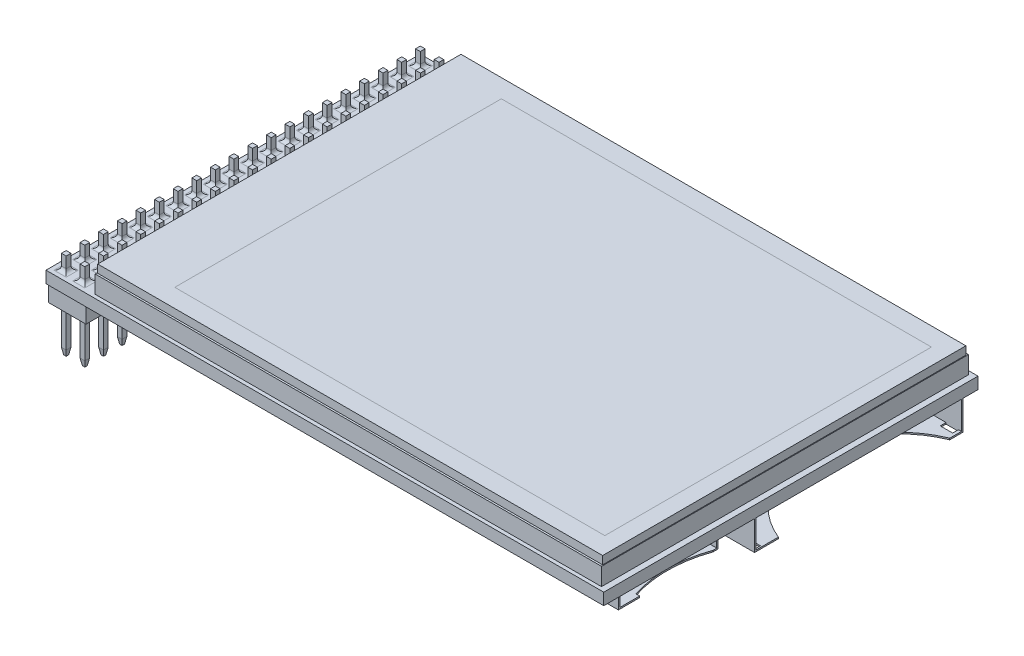
from build123d import *
from OCP.BRepFilletAPI import BRepFilletAPI_MakeChamfer

# Parameters (mm, degrees)
SKETCH_1_W       = 76
SKETCH_1_H       = 51
EXTRUDE_1_DEPTH  = 1.6
SKETCH_2_W       = 5.1
SKETCH_2_H       = 50.5
EXTRUDE_2_DEPTH  = 2.3
SKETCH_3_W       = 0.65
SKETCH_3_H       = 0.65
EXTRUDE_3_DEPTH  = 6.1
SKETCH_4_W       = 0.65
SKETCH_4_H       = 0.65
EXTRUDE_4_DEPTH  = 2
CHAMFER_1_SIZE   = 0.16
CHAMFER_1_SIZE2  = 0.907405091
FILLET_1_R       = 0.5
SKETCH_5_W       = 69
SKETCH_5_H       = 50
EXTRUDE_5_DEPTH  = 2.4
SKETCH_6_W       = 68.8
SKETCH_6_H       = 49.5
EXTRUDE_6_DEPTH  = 1.1
SKETCH_11_W      = 3.6
SKETCH_11_H      = 6.6
SKETCH_11_W_2    = 3.8
SKETCH_11_H_2    = 6.1
EXTRUDE_7_DEPTH  = 1
SKETCH_12_W      = 2.6
SKETCH_12_H      = 1.2
SKETCH_12_W_2    = 2.5
SKETCH_12_H_2    = 3.6
SKETCH_12_W_3    = 2.1
SKETCH_12_H_3    = 0.4
EXTRUDE_8_DEPTH  = 0.25
SKETCH_13_W      = 0.6
SKETCH_13_H      = 1.3
SKETCH_13_W_2    = 1.3
SKETCH_13_H_2    = 0.6
EXTRUDE_9_DEPTH  = 1
EXTRUDE_START    = 0.1
SKETCH_14_W      = 1.6
SKETCH_14_H      = 1.1
SKETCH_14_W_2    = 1.1
SKETCH_14_H_2    = 1.6
EXTRUDE_10_DEPTH = 0.8
EXTRUDE_11_DEPTH = 3.8
SKETCH_16_W      = 1.7
SKETCH_16_H      = 0.8
SKETCH_16_W_2    = 2.5
SKETCH_16_H_2    = 0.3
SKETCH_16_W_3    = 8.9
SKETCH_16_H_3    = 1.1
SKETCH_16_W_4    = 1.8
EXTRUDE_12_DEPTH = 0.2
SKETCH_17_W      = 1.5
SKETCH_17_H      = 1
EXTRUDE_13_DEPTH = 0.25
EXTRUDE_14_DEPTH = 1.8
SKETCH_19_W      = 1.65
SKETCH_19_H      = 3.5
EXTRUDE_15_DEPTH = 0.2


with BuildPart() as part:
    # Эскиз1 → Бобышка-Вытянуть1 (new body)
    with BuildSketch(Plane(origin=(0, 0, 0), x_dir=(1, 0, 0), z_dir=(0, 1, 0))):
        with Locations((38, 0)):
            Rectangle(SKETCH_1_W, SKETCH_1_H)
    extrude(amount=EXTRUDE_1_DEPTH)

    # Эскиз2 → Бобышка-Вытянуть2 (add)
    with BuildSketch(Plane.XZ):
        with Locations((2.65, 0)):
            Rectangle(SKETCH_2_W, SKETCH_2_H)
    extrude(amount=EXTRUDE_2_DEPTH)

    # Эскиз3 → Бобышка-Вытянуть3 (add)
    with BuildSketch(Plane.XZ.offset(2.3)):
        with Locations((1.38, 24.13)):
            Rectangle(SKETCH_3_W, SKETCH_3_H)
        with Locations((1.38, 21.59)):
            Rectangle(SKETCH_3_W, SKETCH_3_H)
        with Locations((1.38, 1.27)):
            Rectangle(SKETCH_3_W, SKETCH_3_H)
        with Locations((1.38, 3.81)):
            Rectangle(SKETCH_3_W, SKETCH_3_H)
        with Locations((1.38, 6.35)):
            Rectangle(SKETCH_3_W, SKETCH_3_H)
        with Locations((1.38, 8.89)):
            Rectangle(SKETCH_3_W, SKETCH_3_H)
        with Locations((1.38, 11.43)):
            Rectangle(SKETCH_3_W, SKETCH_3_H)
        with Locations((1.38, 13.97)):
            Rectangle(SKETCH_3_W, SKETCH_3_H)
        with Locations((1.38, 16.51)):
            Rectangle(SKETCH_3_W, SKETCH_3_H)
        with Locations((1.38, 19.05)):
            Rectangle(SKETCH_3_W, SKETCH_3_H)
        with Locations((1.38, -1.27)):
            Rectangle(SKETCH_3_W, SKETCH_3_H)
        with Locations((1.38, -3.81)):
            Rectangle(SKETCH_3_W, SKETCH_3_H)
        with Locations((1.38, -6.35)):
            Rectangle(SKETCH_3_W, SKETCH_3_H)
        with Locations((1.38, -8.89)):
            Rectangle(SKETCH_3_W, SKETCH_3_H)
        with Locations((1.38, -11.43)):
            Rectangle(SKETCH_3_W, SKETCH_3_H)
        with Locations((1.38, -13.97)):
            Rectangle(SKETCH_3_W, SKETCH_3_H)
        with Locations((1.38, -16.51)):
            Rectangle(SKETCH_3_W, SKETCH_3_H)
        with Locations((1.38, -19.05)):
            Rectangle(SKETCH_3_W, SKETCH_3_H)
        with Locations((1.38, -21.59)):
            Rectangle(SKETCH_3_W, SKETCH_3_H)
        with Locations((1.38, -24.13)):
            Rectangle(SKETCH_3_W, SKETCH_3_H)
        with Locations((3.92, 24.13)):
            Rectangle(SKETCH_3_W, SKETCH_3_H)
        with Locations((3.92, 21.59)):
            Rectangle(SKETCH_3_W, SKETCH_3_H)
        with Locations((3.92, 19.05)):
            Rectangle(SKETCH_3_W, SKETCH_3_H)
        with Locations((3.92, 16.51)):
            Rectangle(SKETCH_3_W, SKETCH_3_H)
        with Locations((3.92, 13.97)):
            Rectangle(SKETCH_3_W, SKETCH_3_H)
        with Locations((3.92, 11.43)):
            Rectangle(SKETCH_3_W, SKETCH_3_H)
        with Locations((3.92, 8.89)):
            Rectangle(SKETCH_3_W, SKETCH_3_H)
        with Locations((3.92, 6.35)):
            Rectangle(SKETCH_3_W, SKETCH_3_H)
        with Locations((3.92, 3.81)):
            Rectangle(SKETCH_3_W, SKETCH_3_H)
        with Locations((3.92, 1.27)):
            Rectangle(SKETCH_3_W, SKETCH_3_H)
        with Locations((3.92, -1.27)):
            Rectangle(SKETCH_3_W, SKETCH_3_H)
        with Locations((3.92, -3.81)):
            Rectangle(SKETCH_3_W, SKETCH_3_H)
        with Locations((3.92, -6.35)):
            Rectangle(SKETCH_3_W, SKETCH_3_H)
        with Locations((3.92, -8.89)):
            Rectangle(SKETCH_3_W, SKETCH_3_H)
        with Locations((3.92, -11.43)):
            Rectangle(SKETCH_3_W, SKETCH_3_H)
        with Locations((3.92, -13.97)):
            Rectangle(SKETCH_3_W, SKETCH_3_H)
        with Locations((3.92, -16.51)):
            Rectangle(SKETCH_3_W, SKETCH_3_H)
        with Locations((3.92, -19.05)):
            Rectangle(SKETCH_3_W, SKETCH_3_H)
        with Locations((3.92, -21.59)):
            Rectangle(SKETCH_3_W, SKETCH_3_H)
        with Locations((3.92, -24.13)):
            Rectangle(SKETCH_3_W, SKETCH_3_H)
    extrude(amount=EXTRUDE_3_DEPTH)

    # Эскиз4 → Бобышка-Вытянуть4 (add)
    with BuildSketch(Plane(origin=(0, 1.6, 0), x_dir=(1, 0, 0), z_dir=(0, 1, 0))):
        with Locations((1.38, 24.13)):
            Rectangle(SKETCH_4_W, SKETCH_4_H)
        with Locations((3.92, 24.13)):
            Rectangle(SKETCH_4_W, SKETCH_4_H)
        with Locations((1.38, 21.59)):
            Rectangle(SKETCH_4_W, SKETCH_4_H)
        with Locations((3.92, 21.59)):
            Rectangle(SKETCH_4_W, SKETCH_4_H)
        with Locations((1.38, 19.05)):
            Rectangle(SKETCH_4_W, SKETCH_4_H)
        with Locations((3.92, 19.05)):
            Rectangle(SKETCH_4_W, SKETCH_4_H)
        with Locations((1.38, 16.51)):
            Rectangle(SKETCH_4_W, SKETCH_4_H)
        with Locations((3.92, 16.51)):
            Rectangle(SKETCH_4_W, SKETCH_4_H)
        with Locations((1.38, 13.97)):
            Rectangle(SKETCH_4_W, SKETCH_4_H)
        with Locations((3.92, 13.97)):
            Rectangle(SKETCH_4_W, SKETCH_4_H)
        with Locations((1.38, 11.43)):
            Rectangle(SKETCH_4_W, SKETCH_4_H)
        with Locations((3.92, 11.43)):
            Rectangle(SKETCH_4_W, SKETCH_4_H)
        with Locations((1.38, 8.89)):
            Rectangle(SKETCH_4_W, SKETCH_4_H)
        with Locations((3.92, 8.89)):
            Rectangle(SKETCH_4_W, SKETCH_4_H)
        with Locations((1.38, 6.35)):
            Rectangle(SKETCH_4_W, SKETCH_4_H)
        with Locations((3.92, 6.35)):
            Rectangle(SKETCH_4_W, SKETCH_4_H)
        with Locations((1.38, 3.81)):
            Rectangle(SKETCH_4_W, SKETCH_4_H)
        with Locations((3.92, 3.81)):
            Rectangle(SKETCH_4_W, SKETCH_4_H)
        with Locations((1.38, 1.27)):
            Rectangle(SKETCH_4_W, SKETCH_4_H)
        with Locations((3.92, 1.27)):
            Rectangle(SKETCH_4_W, SKETCH_4_H)
        with Locations((1.38, -1.27)):
            Rectangle(SKETCH_4_W, SKETCH_4_H)
        with Locations((3.92, -1.27)):
            Rectangle(SKETCH_4_W, SKETCH_4_H)
        with Locations((1.38, -3.81)):
            Rectangle(SKETCH_4_W, SKETCH_4_H)
        with Locations((3.92, -3.81)):
            Rectangle(SKETCH_4_W, SKETCH_4_H)
        with Locations((1.38, -6.35)):
            Rectangle(SKETCH_4_W, SKETCH_4_H)
        with Locations((3.92, -6.35)):
            Rectangle(SKETCH_4_W, SKETCH_4_H)
        with Locations((1.38, -8.89)):
            Rectangle(SKETCH_4_W, SKETCH_4_H)
        with Locations((3.92, -8.89)):
            Rectangle(SKETCH_4_W, SKETCH_4_H)
        with Locations((1.38, -11.43)):
            Rectangle(SKETCH_4_W, SKETCH_4_H)
        with Locations((3.92, -11.43)):
            Rectangle(SKETCH_4_W, SKETCH_4_H)
        with Locations((1.38, -13.97)):
            Rectangle(SKETCH_4_W, SKETCH_4_H)
        with Locations((3.92, -13.97)):
            Rectangle(SKETCH_4_W, SKETCH_4_H)
        with Locations((1.38, -16.51)):
            Rectangle(SKETCH_4_W, SKETCH_4_H)
        with Locations((3.92, -16.51)):
            Rectangle(SKETCH_4_W, SKETCH_4_H)
        with Locations((1.38, -19.05)):
            Rectangle(SKETCH_4_W, SKETCH_4_H)
        with Locations((3.92, -19.05)):
            Rectangle(SKETCH_4_W, SKETCH_4_H)
        with Locations((1.38, -21.59)):
            Rectangle(SKETCH_4_W, SKETCH_4_H)
        with Locations((3.92, -21.59)):
            Rectangle(SKETCH_4_W, SKETCH_4_H)
        with Locations((1.38, -24.13)):
            Rectangle(SKETCH_4_W, SKETCH_4_H)
        with Locations((3.92, -24.13)):
            Rectangle(SKETCH_4_W, SKETCH_4_H)
    extrude(amount=EXTRUDE_4_DEPTH)

    # Фаска1: one chamfer whose edges measure the first distance from different faces: ONE call of the kernel's chamfer builder (chamfer() names one face for all edges)
    chamfer_1_edges_1 = [part.edges().sort_by_distance(p)[0] for p in [
        (1.055, -8.4, 11.43),
        (1.38, -8.4, 11.105),
        (1.705, -8.4, 11.43),
        (1.38, -8.4, 11.755),
    ]]
    chamfer_1_side_1 = [part.faces().sort_by_distance(p)[0] for p in [
        (1.38, -8.4, 11.43),
    ]]
    chamfer_1_edges_2 = [part.edges().sort_by_distance(p)[0] for p in [
        (1.055, -8.4, 13.97),
        (1.38, -8.4, 13.645),
        (1.705, -8.4, 13.97),
        (1.38, -8.4, 14.295),
    ]]
    chamfer_1_side_2 = [part.faces().sort_by_distance(p)[0] for p in [
        (1.38, -8.4, 13.97),
    ]]
    chamfer_1_edges_3 = [part.edges().sort_by_distance(p)[0] for p in [
        (1.055, -8.4, 19.05),
        (1.38, -8.4, 18.725),
        (1.705, -8.4, 19.05),
        (1.38, -8.4, 19.375),
    ]]
    chamfer_1_side_3 = [part.faces().sort_by_distance(p)[0] for p in [
        (1.38, -8.4, 19.05),
    ]]
    chamfer_1_edges_4 = [part.edges().sort_by_distance(p)[0] for p in [
        (1.055, -8.4, 16.51),
        (1.38, -8.4, 16.185),
        (1.705, -8.4, 16.51),
        (1.38, -8.4, 16.835),
    ]]
    chamfer_1_side_4 = [part.faces().sort_by_distance(p)[0] for p in [
        (1.38, -8.4, 16.51),
    ]]
    chamfer_1_edges_5 = [part.edges().sort_by_distance(p)[0] for p in [
        (1.055, -8.4, -3.81),
        (1.38, -8.4, -4.135),
        (1.705, -8.4, -3.81),
        (1.38, -8.4, -3.485),
    ]]
    chamfer_1_side_5 = [part.faces().sort_by_distance(p)[0] for p in [
        (1.38, -8.4, -3.81),
    ]]
    chamfer_1_edges_6 = [part.edges().sort_by_distance(p)[0] for p in [
        (1.055, -8.4, -6.35),
        (1.38, -8.4, -6.675),
        (1.705, -8.4, -6.35),
        (1.38, -8.4, -6.025),
    ]]
    chamfer_1_side_6 = [part.faces().sort_by_distance(p)[0] for p in [
        (1.38, -8.4, -6.35),
    ]]
    chamfer_1_edges_7 = [part.edges().sort_by_distance(p)[0] for p in [
        (1.055, -8.4, -8.89),
        (1.38, -8.4, -9.215),
        (1.705, -8.4, -8.89),
        (1.38, -8.4, -8.565),
    ]]
    chamfer_1_side_7 = [part.faces().sort_by_distance(p)[0] for p in [
        (1.38, -8.4, -8.89),
    ]]
    chamfer_1_edges_8 = [part.edges().sort_by_distance(p)[0] for p in [
        (1.055, -8.4, -11.43),
        (1.38, -8.4, -11.755),
        (1.705, -8.4, -11.43),
        (1.38, -8.4, -11.105),
    ]]
    chamfer_1_side_8 = [part.faces().sort_by_distance(p)[0] for p in [
        (1.38, -8.4, -11.43),
    ]]
    chamfer_1_edges_9 = [part.edges().sort_by_distance(p)[0] for p in [
        (1.055, -8.4, -13.97),
        (1.38, -8.4, -14.295),
        (1.705, -8.4, -13.97),
        (1.38, -8.4, -13.645),
    ]]
    chamfer_1_side_9 = [part.faces().sort_by_distance(p)[0] for p in [
        (1.38, -8.4, -13.97),
    ]]
    chamfer_1_edges_10 = [part.edges().sort_by_distance(p)[0] for p in [
        (1.055, -8.4, -16.51),
        (1.38, -8.4, -16.835),
        (1.705, -8.4, -16.51),
        (1.38, -8.4, -16.185),
    ]]
    chamfer_1_side_10 = [part.faces().sort_by_distance(p)[0] for p in [
        (1.38, -8.4, -16.51),
    ]]
    chamfer_1_edges_11 = [part.edges().sort_by_distance(p)[0] for p in [
        (1.055, -8.4, -19.05),
        (1.38, -8.4, -19.375),
        (1.705, -8.4, -19.05),
        (1.38, -8.4, -18.725),
    ]]
    chamfer_1_side_11 = [part.faces().sort_by_distance(p)[0] for p in [
        (1.38, -8.4, -19.05),
    ]]
    chamfer_1_edges_12 = [part.edges().sort_by_distance(p)[0] for p in [
        (1.055, -8.4, -21.59),
        (1.38, -8.4, -21.915),
        (1.705, -8.4, -21.59),
        (1.38, -8.4, -21.265),
    ]]
    chamfer_1_side_12 = [part.faces().sort_by_distance(p)[0] for p in [
        (1.38, -8.4, -21.59),
    ]]
    chamfer_1_edges_13 = [part.edges().sort_by_distance(p)[0] for p in [
        (1.055, -8.4, -24.13),
        (1.38, -8.4, -24.455),
        (1.705, -8.4, -24.13),
        (1.38, -8.4, -23.805),
    ]]
    chamfer_1_side_13 = [part.faces().sort_by_distance(p)[0] for p in [
        (1.38, -8.4, -24.13),
    ]]
    chamfer_1_edges_14 = [part.edges().sort_by_distance(p)[0] for p in [
        (3.595, -8.4, 21.59),
        (3.92, -8.4, 21.265),
        (4.245, -8.4, 21.59),
        (3.92, -8.4, 21.915),
    ]]
    chamfer_1_side_14 = [part.faces().sort_by_distance(p)[0] for p in [
        (3.92, -8.4, 21.59),
    ]]
    chamfer_1_edges_15 = [part.edges().sort_by_distance(p)[0] for p in [
        (3.595, -8.4, 24.13),
        (3.92, -8.4, 23.805),
        (4.245, -8.4, 24.13),
        (3.92, -8.4, 24.455),
    ]]
    chamfer_1_side_15 = [part.faces().sort_by_distance(p)[0] for p in [
        (3.92, -8.4, 24.13),
    ]]
    chamfer_1_edges_16 = [part.edges().sort_by_distance(p)[0] for p in [
        (3.595, -8.4, 19.05),
        (3.92, -8.4, 18.725),
        (4.245, -8.4, 19.05),
        (3.92, -8.4, 19.375),
    ]]
    chamfer_1_side_16 = [part.faces().sort_by_distance(p)[0] for p in [
        (3.92, -8.4, 19.05),
    ]]
    chamfer_1_edges_17 = [part.edges().sort_by_distance(p)[0] for p in [
        (3.595, -8.4, 16.51),
        (3.92, -8.4, 16.185),
        (4.245, -8.4, 16.51),
        (3.92, -8.4, 16.835),
    ]]
    chamfer_1_side_17 = [part.faces().sort_by_distance(p)[0] for p in [
        (3.92, -8.4, 16.51),
    ]]
    chamfer_1_edges_18 = [part.edges().sort_by_distance(p)[0] for p in [
        (3.595, -8.4, 13.97),
        (3.92, -8.4, 13.645),
        (4.245, -8.4, 13.97),
        (3.92, -8.4, 14.295),
    ]]
    chamfer_1_side_18 = [part.faces().sort_by_distance(p)[0] for p in [
        (3.92, -8.4, 13.97),
    ]]
    chamfer_1_edges_19 = [part.edges().sort_by_distance(p)[0] for p in [
        (3.595, -8.4, 11.43),
        (3.92, -8.4, 11.105),
        (4.245, -8.4, 11.43),
        (3.92, -8.4, 11.755),
    ]]
    chamfer_1_side_19 = [part.faces().sort_by_distance(p)[0] for p in [
        (3.92, -8.4, 11.43),
    ]]
    chamfer_1_edges_20 = [part.edges().sort_by_distance(p)[0] for p in [
        (3.595, -8.4, 8.89),
        (3.92, -8.4, 8.565),
        (4.245, -8.4, 8.89),
        (3.92, -8.4, 9.215),
    ]]
    chamfer_1_side_20 = [part.faces().sort_by_distance(p)[0] for p in [
        (3.92, -8.4, 8.89),
    ]]
    chamfer_1_edges_21 = [part.edges().sort_by_distance(p)[0] for p in [
        (3.595, -8.4, 6.35),
        (3.92, -8.4, 6.025),
        (4.245, -8.4, 6.35),
        (3.92, -8.4, 6.675),
    ]]
    chamfer_1_side_21 = [part.faces().sort_by_distance(p)[0] for p in [
        (3.92, -8.4, 6.35),
    ]]
    chamfer_1_edges_22 = [part.edges().sort_by_distance(p)[0] for p in [
        (1.055, -8.4, 24.13),
        (1.38, -8.4, 23.805),
        (1.705, -8.4, 24.13),
        (1.38, -8.4, 24.455),
    ]]
    chamfer_1_side_22 = [part.faces().sort_by_distance(p)[0] for p in [
        (1.38, -8.4, 24.13),
    ]]
    chamfer_1_edges_23 = [part.edges().sort_by_distance(p)[0] for p in [
        (3.595, -8.4, 3.81),
        (3.92, -8.4, 3.485),
        (4.245, -8.4, 3.81),
        (3.92, -8.4, 4.135),
    ]]
    chamfer_1_side_23 = [part.faces().sort_by_distance(p)[0] for p in [
        (3.92, -8.4, 3.81),
    ]]
    chamfer_1_edges_24 = [part.edges().sort_by_distance(p)[0] for p in [
        (3.595, -8.4, 1.27),
        (3.92, -8.4, 0.945),
        (4.245, -8.4, 1.27),
        (3.92, -8.4, 1.595),
    ]]
    chamfer_1_side_24 = [part.faces().sort_by_distance(p)[0] for p in [
        (3.92, -8.4, 1.27),
    ]]
    chamfer_1_edges_25 = [part.edges().sort_by_distance(p)[0] for p in [
        (3.595, -8.4, -1.27),
        (3.92, -8.4, -1.595),
        (4.245, -8.4, -1.27),
        (3.92, -8.4, -0.945),
    ]]
    chamfer_1_side_25 = [part.faces().sort_by_distance(p)[0] for p in [
        (3.92, -8.4, -1.27),
    ]]
    chamfer_1_edges_26 = [part.edges().sort_by_distance(p)[0] for p in [
        (3.595, -8.4, -3.81),
        (3.92, -8.4, -4.135),
        (4.245, -8.4, -3.81),
        (3.92, -8.4, -3.485),
    ]]
    chamfer_1_side_26 = [part.faces().sort_by_distance(p)[0] for p in [
        (3.92, -8.4, -3.81),
    ]]
    chamfer_1_edges_27 = [part.edges().sort_by_distance(p)[0] for p in [
        (3.595, -8.4, -6.35),
        (3.92, -8.4, -6.675),
        (4.245, -8.4, -6.35),
        (3.92, -8.4, -6.025),
    ]]
    chamfer_1_side_27 = [part.faces().sort_by_distance(p)[0] for p in [
        (3.92, -8.4, -6.35),
    ]]
    chamfer_1_edges_28 = [part.edges().sort_by_distance(p)[0] for p in [
        (3.595, -8.4, -8.89),
        (3.92, -8.4, -9.215),
        (4.245, -8.4, -8.89),
        (3.92, -8.4, -8.565),
    ]]
    chamfer_1_side_28 = [part.faces().sort_by_distance(p)[0] for p in [
        (3.92, -8.4, -8.89),
    ]]
    chamfer_1_edges_29 = [part.edges().sort_by_distance(p)[0] for p in [
        (3.595, -8.4, -11.43),
        (3.92, -8.4, -11.755),
        (4.245, -8.4, -11.43),
        (3.92, -8.4, -11.105),
    ]]
    chamfer_1_side_29 = [part.faces().sort_by_distance(p)[0] for p in [
        (3.92, -8.4, -11.43),
    ]]
    chamfer_1_edges_30 = [part.edges().sort_by_distance(p)[0] for p in [
        (3.595, -8.4, -13.97),
        (3.92, -8.4, -14.295),
        (4.245, -8.4, -13.97),
        (3.92, -8.4, -13.645),
    ]]
    chamfer_1_side_30 = [part.faces().sort_by_distance(p)[0] for p in [
        (3.92, -8.4, -13.97),
    ]]
    chamfer_1_edges_31 = [part.edges().sort_by_distance(p)[0] for p in [
        (3.595, -8.4, -16.51),
        (3.92, -8.4, -16.835),
        (4.245, -8.4, -16.51),
        (3.92, -8.4, -16.185),
    ]]
    chamfer_1_side_31 = [part.faces().sort_by_distance(p)[0] for p in [
        (3.92, -8.4, -16.51),
    ]]
    chamfer_1_edges_32 = [part.edges().sort_by_distance(p)[0] for p in [
        (3.595, -8.4, -19.05),
        (3.92, -8.4, -19.375),
        (4.245, -8.4, -19.05),
        (3.92, -8.4, -18.725),
    ]]
    chamfer_1_side_32 = [part.faces().sort_by_distance(p)[0] for p in [
        (3.92, -8.4, -19.05),
    ]]
    chamfer_1_edges_33 = [part.edges().sort_by_distance(p)[0] for p in [
        (1.055, -8.4, 21.59),
        (1.38, -8.4, 21.265),
        (1.705, -8.4, 21.59),
        (1.38, -8.4, 21.915),
    ]]
    chamfer_1_side_33 = [part.faces().sort_by_distance(p)[0] for p in [
        (1.38, -8.4, 21.59),
    ]]
    chamfer_1_edges_34 = [part.edges().sort_by_distance(p)[0] for p in [
        (3.595, -8.4, -21.59),
        (3.92, -8.4, -21.915),
        (4.245, -8.4, -21.59),
        (3.92, -8.4, -21.265),
    ]]
    chamfer_1_side_34 = [part.faces().sort_by_distance(p)[0] for p in [
        (3.92, -8.4, -21.59),
    ]]
    chamfer_1_edges_35 = [part.edges().sort_by_distance(p)[0] for p in [
        (3.595, -8.4, -24.13),
        (3.92, -8.4, -24.455),
        (4.245, -8.4, -24.13),
        (3.92, -8.4, -23.805),
    ]]
    chamfer_1_side_35 = [part.faces().sort_by_distance(p)[0] for p in [
        (3.92, -8.4, -24.13),
    ]]
    chamfer_1_edges_36 = [part.edges().sort_by_distance(p)[0] for p in [
        (1.055, -8.4, 3.81),
        (1.38, -8.4, 3.485),
        (1.705, -8.4, 3.81),
        (1.38, -8.4, 4.135),
    ]]
    chamfer_1_side_36 = [part.faces().sort_by_distance(p)[0] for p in [
        (1.38, -8.4, 3.81),
    ]]
    chamfer_1_edges_37 = [part.edges().sort_by_distance(p)[0] for p in [
        (1.055, -8.4, -1.27),
        (1.38, -8.4, -1.595),
        (1.705, -8.4, -1.27),
        (1.38, -8.4, -0.945),
    ]]
    chamfer_1_side_37 = [part.faces().sort_by_distance(p)[0] for p in [
        (1.38, -8.4, -1.27),
    ]]
    chamfer_1_edges_38 = [part.edges().sort_by_distance(p)[0] for p in [
        (1.055, -8.4, 1.27),
        (1.38, -8.4, 0.945),
        (1.705, -8.4, 1.27),
        (1.38, -8.4, 1.595),
    ]]
    chamfer_1_side_38 = [part.faces().sort_by_distance(p)[0] for p in [
        (1.38, -8.4, 1.27),
    ]]
    chamfer_1_edges_39 = [part.edges().sort_by_distance(p)[0] for p in [
        (1.055, -8.4, 6.35),
        (1.38, -8.4, 6.025),
        (1.705, -8.4, 6.35),
        (1.38, -8.4, 6.675),
    ]]
    chamfer_1_side_39 = [part.faces().sort_by_distance(p)[0] for p in [
        (1.38, -8.4, 6.35),
    ]]
    chamfer_1_edges_40 = [part.edges().sort_by_distance(p)[0] for p in [
        (1.055, -8.4, 8.89),
        (1.38, -8.4, 8.565),
        (1.705, -8.4, 8.89),
        (1.38, -8.4, 9.215),
    ]]
    chamfer_1_side_40 = [part.faces().sort_by_distance(p)[0] for p in [
        (1.38, -8.4, 8.89),
    ]]
    chamfer_1 = BRepFilletAPI_MakeChamfer(part.part.solid().wrapped)
    for e in chamfer_1_edges_1:
        chamfer_1.Add(CHAMFER_1_SIZE, CHAMFER_1_SIZE2, e.wrapped, chamfer_1_side_1[0].wrapped)  # the first distance lies on this face
    for e in chamfer_1_edges_2:
        chamfer_1.Add(CHAMFER_1_SIZE, CHAMFER_1_SIZE2, e.wrapped, chamfer_1_side_2[0].wrapped)  # the first distance lies on this face
    for e in chamfer_1_edges_3:
        chamfer_1.Add(CHAMFER_1_SIZE, CHAMFER_1_SIZE2, e.wrapped, chamfer_1_side_3[0].wrapped)  # the first distance lies on this face
    for e in chamfer_1_edges_4:
        chamfer_1.Add(CHAMFER_1_SIZE, CHAMFER_1_SIZE2, e.wrapped, chamfer_1_side_4[0].wrapped)  # the first distance lies on this face
    for e in chamfer_1_edges_5:
        chamfer_1.Add(CHAMFER_1_SIZE, CHAMFER_1_SIZE2, e.wrapped, chamfer_1_side_5[0].wrapped)  # the first distance lies on this face
    for e in chamfer_1_edges_6:
        chamfer_1.Add(CHAMFER_1_SIZE, CHAMFER_1_SIZE2, e.wrapped, chamfer_1_side_6[0].wrapped)  # the first distance lies on this face
    for e in chamfer_1_edges_7:
        chamfer_1.Add(CHAMFER_1_SIZE, CHAMFER_1_SIZE2, e.wrapped, chamfer_1_side_7[0].wrapped)  # the first distance lies on this face
    for e in chamfer_1_edges_8:
        chamfer_1.Add(CHAMFER_1_SIZE, CHAMFER_1_SIZE2, e.wrapped, chamfer_1_side_8[0].wrapped)  # the first distance lies on this face
    for e in chamfer_1_edges_9:
        chamfer_1.Add(CHAMFER_1_SIZE, CHAMFER_1_SIZE2, e.wrapped, chamfer_1_side_9[0].wrapped)  # the first distance lies on this face
    for e in chamfer_1_edges_10:
        chamfer_1.Add(CHAMFER_1_SIZE, CHAMFER_1_SIZE2, e.wrapped, chamfer_1_side_10[0].wrapped)  # the first distance lies on this face
    for e in chamfer_1_edges_11:
        chamfer_1.Add(CHAMFER_1_SIZE, CHAMFER_1_SIZE2, e.wrapped, chamfer_1_side_11[0].wrapped)  # the first distance lies on this face
    for e in chamfer_1_edges_12:
        chamfer_1.Add(CHAMFER_1_SIZE, CHAMFER_1_SIZE2, e.wrapped, chamfer_1_side_12[0].wrapped)  # the first distance lies on this face
    for e in chamfer_1_edges_13:
        chamfer_1.Add(CHAMFER_1_SIZE, CHAMFER_1_SIZE2, e.wrapped, chamfer_1_side_13[0].wrapped)  # the first distance lies on this face
    for e in chamfer_1_edges_14:
        chamfer_1.Add(CHAMFER_1_SIZE, CHAMFER_1_SIZE2, e.wrapped, chamfer_1_side_14[0].wrapped)  # the first distance lies on this face
    for e in chamfer_1_edges_15:
        chamfer_1.Add(CHAMFER_1_SIZE, CHAMFER_1_SIZE2, e.wrapped, chamfer_1_side_15[0].wrapped)  # the first distance lies on this face
    for e in chamfer_1_edges_16:
        chamfer_1.Add(CHAMFER_1_SIZE, CHAMFER_1_SIZE2, e.wrapped, chamfer_1_side_16[0].wrapped)  # the first distance lies on this face
    for e in chamfer_1_edges_17:
        chamfer_1.Add(CHAMFER_1_SIZE, CHAMFER_1_SIZE2, e.wrapped, chamfer_1_side_17[0].wrapped)  # the first distance lies on this face
    for e in chamfer_1_edges_18:
        chamfer_1.Add(CHAMFER_1_SIZE, CHAMFER_1_SIZE2, e.wrapped, chamfer_1_side_18[0].wrapped)  # the first distance lies on this face
    for e in chamfer_1_edges_19:
        chamfer_1.Add(CHAMFER_1_SIZE, CHAMFER_1_SIZE2, e.wrapped, chamfer_1_side_19[0].wrapped)  # the first distance lies on this face
    for e in chamfer_1_edges_20:
        chamfer_1.Add(CHAMFER_1_SIZE, CHAMFER_1_SIZE2, e.wrapped, chamfer_1_side_20[0].wrapped)  # the first distance lies on this face
    for e in chamfer_1_edges_21:
        chamfer_1.Add(CHAMFER_1_SIZE, CHAMFER_1_SIZE2, e.wrapped, chamfer_1_side_21[0].wrapped)  # the first distance lies on this face
    for e in chamfer_1_edges_22:
        chamfer_1.Add(CHAMFER_1_SIZE, CHAMFER_1_SIZE2, e.wrapped, chamfer_1_side_22[0].wrapped)  # the first distance lies on this face
    for e in chamfer_1_edges_23:
        chamfer_1.Add(CHAMFER_1_SIZE, CHAMFER_1_SIZE2, e.wrapped, chamfer_1_side_23[0].wrapped)  # the first distance lies on this face
    for e in chamfer_1_edges_24:
        chamfer_1.Add(CHAMFER_1_SIZE, CHAMFER_1_SIZE2, e.wrapped, chamfer_1_side_24[0].wrapped)  # the first distance lies on this face
    for e in chamfer_1_edges_25:
        chamfer_1.Add(CHAMFER_1_SIZE, CHAMFER_1_SIZE2, e.wrapped, chamfer_1_side_25[0].wrapped)  # the first distance lies on this face
    for e in chamfer_1_edges_26:
        chamfer_1.Add(CHAMFER_1_SIZE, CHAMFER_1_SIZE2, e.wrapped, chamfer_1_side_26[0].wrapped)  # the first distance lies on this face
    for e in chamfer_1_edges_27:
        chamfer_1.Add(CHAMFER_1_SIZE, CHAMFER_1_SIZE2, e.wrapped, chamfer_1_side_27[0].wrapped)  # the first distance lies on this face
    for e in chamfer_1_edges_28:
        chamfer_1.Add(CHAMFER_1_SIZE, CHAMFER_1_SIZE2, e.wrapped, chamfer_1_side_28[0].wrapped)  # the first distance lies on this face
    for e in chamfer_1_edges_29:
        chamfer_1.Add(CHAMFER_1_SIZE, CHAMFER_1_SIZE2, e.wrapped, chamfer_1_side_29[0].wrapped)  # the first distance lies on this face
    for e in chamfer_1_edges_30:
        chamfer_1.Add(CHAMFER_1_SIZE, CHAMFER_1_SIZE2, e.wrapped, chamfer_1_side_30[0].wrapped)  # the first distance lies on this face
    for e in chamfer_1_edges_31:
        chamfer_1.Add(CHAMFER_1_SIZE, CHAMFER_1_SIZE2, e.wrapped, chamfer_1_side_31[0].wrapped)  # the first distance lies on this face
    for e in chamfer_1_edges_32:
        chamfer_1.Add(CHAMFER_1_SIZE, CHAMFER_1_SIZE2, e.wrapped, chamfer_1_side_32[0].wrapped)  # the first distance lies on this face
    for e in chamfer_1_edges_33:
        chamfer_1.Add(CHAMFER_1_SIZE, CHAMFER_1_SIZE2, e.wrapped, chamfer_1_side_33[0].wrapped)  # the first distance lies on this face
    for e in chamfer_1_edges_34:
        chamfer_1.Add(CHAMFER_1_SIZE, CHAMFER_1_SIZE2, e.wrapped, chamfer_1_side_34[0].wrapped)  # the first distance lies on this face
    for e in chamfer_1_edges_35:
        chamfer_1.Add(CHAMFER_1_SIZE, CHAMFER_1_SIZE2, e.wrapped, chamfer_1_side_35[0].wrapped)  # the first distance lies on this face
    for e in chamfer_1_edges_36:
        chamfer_1.Add(CHAMFER_1_SIZE, CHAMFER_1_SIZE2, e.wrapped, chamfer_1_side_36[0].wrapped)  # the first distance lies on this face
    for e in chamfer_1_edges_37:
        chamfer_1.Add(CHAMFER_1_SIZE, CHAMFER_1_SIZE2, e.wrapped, chamfer_1_side_37[0].wrapped)  # the first distance lies on this face
    for e in chamfer_1_edges_38:
        chamfer_1.Add(CHAMFER_1_SIZE, CHAMFER_1_SIZE2, e.wrapped, chamfer_1_side_38[0].wrapped)  # the first distance lies on this face
    for e in chamfer_1_edges_39:
        chamfer_1.Add(CHAMFER_1_SIZE, CHAMFER_1_SIZE2, e.wrapped, chamfer_1_side_39[0].wrapped)  # the first distance lies on this face
    for e in chamfer_1_edges_40:
        chamfer_1.Add(CHAMFER_1_SIZE, CHAMFER_1_SIZE2, e.wrapped, chamfer_1_side_40[0].wrapped)  # the first distance lies on this face
    add(Compound.cast(chamfer_1.Shape()), mode=Mode.REPLACE)

    # Скругление1
    fillet_1_edges = [part.edges().sort_by_distance(p)[0] for p in [
        (1.055, 1.6, -24.13),
        (1.38, 1.6, -23.805),
        (1.705, 1.6, -24.13),
        (1.38, 1.6, -24.455),
        (1.055, 1.6, -21.59),
        (1.38, 1.6, -21.265),
        (1.705, 1.6, -21.59),
        (1.38, 1.6, -21.915),
        (3.595, 1.6, -24.13),
        (3.92, 1.6, -23.805),
        (4.245, 1.6, -24.13),
        (3.92, 1.6, -24.455),
        (3.595, 1.6, -21.59),
        (3.92, 1.6, -21.265),
        (4.245, 1.6, -21.59),
        (3.92, 1.6, -21.915),
        (1.055, 1.6, -19.05),
        (1.38, 1.6, -18.725),
        (1.705, 1.6, -19.05),
        (1.38, 1.6, -19.375),
        (3.595, 1.6, -19.05),
        (3.92, 1.6, -18.725),
        (4.245, 1.6, -19.05),
        (3.92, 1.6, -19.375),
        (1.055, 1.6, -16.51),
        (1.38, 1.6, -16.185),
        (1.705, 1.6, -16.51),
        (1.38, 1.6, -16.835),
        (3.595, 1.6, -16.51),
        (3.92, 1.6, -16.185),
        (4.245, 1.6, -16.51),
        (3.92, 1.6, -16.835),
        (1.055, 1.6, -13.97),
        (1.38, 1.6, -13.645),
        (1.705, 1.6, -13.97),
        (1.38, 1.6, -14.295),
        (3.595, 1.6, -13.97),
        (3.92, 1.6, -13.645),
        (4.245, 1.6, -13.97),
        (3.92, 1.6, -14.295),
        (1.055, 1.6, -11.43),
        (1.38, 1.6, -11.105),
        (1.705, 1.6, -11.43),
        (1.38, 1.6, -11.755),
        (3.595, 1.6, -11.43),
        (3.92, 1.6, -11.105),
        (4.245, 1.6, -11.43),
        (3.92, 1.6, -11.755),
        (1.055, 1.6, -8.89),
        (1.38, 1.6, -8.565),
        (1.705, 1.6, -8.89),
        (1.38, 1.6, -9.215),
        (3.595, 1.6, -8.89),
        (3.92, 1.6, -8.565),
        (4.245, 1.6, -8.89),
        (3.92, 1.6, -9.215),
        (1.055, 1.6, -6.35),
        (1.38, 1.6, -6.025),
        (1.705, 1.6, -6.35),
        (1.38, 1.6, -6.675),
        (3.595, 1.6, -6.35),
        (3.92, 1.6, -6.025),
        (4.245, 1.6, -6.35),
        (3.92, 1.6, -6.675),
        (1.055, 1.6, -3.81),
        (1.38, 1.6, -3.485),
        (1.705, 1.6, -3.81),
        (1.38, 1.6, -4.135),
        (3.595, 1.6, -3.81),
        (3.92, 1.6, -3.485),
        (4.245, 1.6, -3.81),
        (3.92, 1.6, -4.135),
        (1.055, 1.6, -1.27),
        (1.38, 1.6, -0.945),
        (1.705, 1.6, -1.27),
        (1.38, 1.6, -1.595),
        (3.595, 1.6, -1.27),
        (3.92, 1.6, -0.945),
        (4.245, 1.6, -1.27),
        (3.92, 1.6, -1.595),
        (1.055, 1.6, 1.27),
        (1.38, 1.6, 1.595),
        (1.705, 1.6, 1.27),
        (1.38, 1.6, 0.945),
        (3.595, 1.6, 1.27),
        (3.92, 1.6, 1.595),
        (4.245, 1.6, 1.27),
        (3.92, 1.6, 0.945),
        (1.055, 1.6, 3.81),
        (1.38, 1.6, 4.135),
        (1.705, 1.6, 3.81),
        (1.38, 1.6, 3.485),
        (3.595, 1.6, 3.81),
        (3.92, 1.6, 4.135),
        (4.245, 1.6, 3.81),
        (3.92, 1.6, 3.485),
        (1.055, 1.6, 6.35),
        (1.38, 1.6, 6.675),
        (1.705, 1.6, 6.35),
        (1.38, 1.6, 6.025),
        (3.595, 1.6, 6.35),
        (3.92, 1.6, 6.675),
        (4.245, 1.6, 6.35),
        (3.92, 1.6, 6.025),
        (1.055, 1.6, 8.89),
        (1.38, 1.6, 9.215),
        (1.705, 1.6, 8.89),
        (1.38, 1.6, 8.565),
        (3.595, 1.6, 8.89),
        (3.92, 1.6, 9.215),
        (4.245, 1.6, 8.89),
        (3.92, 1.6, 8.565),
        (1.055, 1.6, 11.43),
        (1.38, 1.6, 11.755),
        (1.705, 1.6, 11.43),
        (1.38, 1.6, 11.105),
        (3.595, 1.6, 11.43),
        (3.92, 1.6, 11.755),
        (4.245, 1.6, 11.43),
        (3.92, 1.6, 11.105),
        (1.055, 1.6, 13.97),
        (1.38, 1.6, 14.295),
        (1.705, 1.6, 13.97),
        (1.38, 1.6, 13.645),
        (3.595, 1.6, 13.97),
        (3.92, 1.6, 14.295),
        (4.245, 1.6, 13.97),
        (3.92, 1.6, 13.645),
        (1.055, 1.6, 16.51),
        (1.38, 1.6, 16.835),
        (1.705, 1.6, 16.51),
        (1.38, 1.6, 16.185),
        (3.595, 1.6, 16.51),
        (3.92, 1.6, 16.835),
        (4.245, 1.6, 16.51),
        (3.92, 1.6, 16.185),
        (1.055, 1.6, 19.05),
        (1.38, 1.6, 19.375),
        (1.705, 1.6, 19.05),
        (1.38, 1.6, 18.725),
        (3.595, 1.6, 19.05),
        (3.92, 1.6, 19.375),
        (4.245, 1.6, 19.05),
        (3.92, 1.6, 18.725),
        (1.055, 1.6, 21.59),
        (1.38, 1.6, 21.915),
        (1.705, 1.6, 21.59),
        (1.38, 1.6, 21.265),
        (3.595, 1.6, 21.59),
        (3.92, 1.6, 21.915),
        (4.245, 1.6, 21.59),
        (3.92, 1.6, 21.265),
        (1.055, 1.6, 24.13),
        (1.38, 1.6, 24.455),
        (1.705, 1.6, 24.13),
        (1.38, 1.6, 23.805),
        (3.595, 1.6, 24.13),
        (3.92, 1.6, 24.455),
        (4.245, 1.6, 24.13),
        (3.92, 1.6, 23.805),
    ]]
    fillet(fillet_1_edges, radius=FILLET_1_R)

    # Эскиз5 → Бобышка-Вытянуть5 (add)
    with BuildSketch(Plane(origin=(0, 1.6, 0), x_dir=(1, 0, 0), z_dir=(0, 1, 0))):
        with Locations((40.7, 0)):
            Rectangle(SKETCH_5_W, SKETCH_5_H)
    extrude(amount=EXTRUDE_5_DEPTH)

    # Эскиз6 → Бобышка-Вытянуть6 (add)
    with BuildSketch(Plane(origin=(0, 4, 0), x_dir=(1, 0, 0), z_dir=(0, 1, 0))):
        with Locations((40.7, 0)):
            Rectangle(SKETCH_6_W, SKETCH_6_H)
    extrude(amount=EXTRUDE_6_DEPTH)

    # Эскиз11 → Бобышка-Вытянуть7 (add)
    with BuildSketch(Plane.XZ):
        with Locations((16.6, -14.6)):
            Rectangle(SKETCH_11_W, SKETCH_11_H)
        with Locations((18, 3.25)):
            Rectangle(SKETCH_11_W_2, SKETCH_11_H_2)
    extrude(amount=EXTRUDE_7_DEPTH)

    # Эскиз12 → Бобышка-Вытянуть8 (add)
    with BuildSketch(Plane.XZ):
        with Locations((13.5, -17)):
            Rectangle(SKETCH_12_W, SKETCH_12_H)
        with Locations((13.5, -14.6)):
            Rectangle(SKETCH_12_W, SKETCH_12_H)
        with Locations((13.5, -12.2)):
            Rectangle(SKETCH_12_W, SKETCH_12_H)
        with Locations((19.65, -14.6)):
            Rectangle(SKETCH_12_W_2, SKETCH_12_H_2)
        with Locations((15.05, 0.975)):
            Rectangle(SKETCH_12_W_3, SKETCH_12_H_3)
        with Locations((15.05, 1.625)):
            Rectangle(SKETCH_12_W_3, SKETCH_12_H_3)
        with Locations((15.05, 2.275)):
            Rectangle(SKETCH_12_W_3, SKETCH_12_H_3)
        with Locations((15.05, 2.925)):
            Rectangle(SKETCH_12_W_3, SKETCH_12_H_3)
        with Locations((15.05, 3.575)):
            Rectangle(SKETCH_12_W_3, SKETCH_12_H_3)
        with Locations((15.05, 4.225)):
            Rectangle(SKETCH_12_W_3, SKETCH_12_H_3)
        with Locations((15.05, 4.875)):
            Rectangle(SKETCH_12_W_3, SKETCH_12_H_3)
        with Locations((15.05, 5.525)):
            Rectangle(SKETCH_12_W_3, SKETCH_12_H_3)
        with Locations((20.95, 5.525)):
            Rectangle(SKETCH_12_W_3, SKETCH_12_H_3)
        with Locations((20.95, 4.875)):
            Rectangle(SKETCH_12_W_3, SKETCH_12_H_3)
        with Locations((20.95, 4.225)):
            Rectangle(SKETCH_12_W_3, SKETCH_12_H_3)
        with Locations((20.95, 3.575)):
            Rectangle(SKETCH_12_W_3, SKETCH_12_H_3)
        with Locations((20.95, 2.925)):
            Rectangle(SKETCH_12_W_3, SKETCH_12_H_3)
        with Locations((20.95, 2.275)):
            Rectangle(SKETCH_12_W_3, SKETCH_12_H_3)
        with Locations((20.95, 1.625)):
            Rectangle(SKETCH_12_W_3, SKETCH_12_H_3)
        with Locations((20.95, 0.975)):
            Rectangle(SKETCH_12_W_3, SKETCH_12_H_3)
    extrude(amount=EXTRUDE_8_DEPTH)

    # Эскиз13 → Бобышка-Вытянуть9 (add)
    with BuildSketch(Plane.XZ):
        with Locations((12.65, -20.3)):
            Rectangle(SKETCH_13_W, SKETCH_13_H)
        with Locations((14.85, -20.3)):
            Rectangle(SKETCH_13_W, SKETCH_13_H)
        with Locations((14.7, -1.65)):
            Rectangle(SKETCH_13_W, SKETCH_13_H)
        with Locations((16.9, -1.65)):
            Rectangle(SKETCH_13_W, SKETCH_13_H)
        with Locations((19.45, -1.65)):
            Rectangle(SKETCH_13_W, SKETCH_13_H)
        with Locations((21.65, -1.65)):
            Rectangle(SKETCH_13_W, SKETCH_13_H)
        with Locations((25.9, 3.1)):
            Rectangle(SKETCH_13_W_2, SKETCH_13_H_2)
        with Locations((25.9, 5.3)):
            Rectangle(SKETCH_13_W_2, SKETCH_13_H_2)
    extrude(amount=EXTRUDE_9_DEPTH)

    # Эскиз14 → Бобышка-Вытянуть10 (add)
    with BuildSketch(Plane.XZ.offset(EXTRUDE_START)):
        with Locations((13.75, -20.3)):
            Rectangle(SKETCH_14_W, SKETCH_14_H)
        with Locations((15.8, -1.65)):
            Rectangle(SKETCH_14_W, SKETCH_14_H)
        with Locations((20.55, -1.65)):
            Rectangle(SKETCH_14_W, SKETCH_14_H)
        with Locations((25.9, 4.2)):
            Rectangle(SKETCH_14_W_2, SKETCH_14_H_2)
    extrude(amount=EXTRUDE_10_DEPTH)

    # Эскиз15 → Бобышка-Вытянуть11 (add)
    with BuildSketch(Plane.XZ):
        Polygon((47, -23.45), (76, -23.45), (76, -23.25), (47.2, -23.25), (47.2, 4.75), (76, 4.75), (76, 4.95), (47, 4.95), align=None)
    extrude(amount=EXTRUDE_11_DEPTH)

    # Эскиз16 → Бобышка-Вытянуть12 (add)
    with BuildSketch(Plane.XZ.offset(3.8)):
        with BuildLine():
            Line((47, 4.95), (47, -23.45))
            Line((47, -23.45), (76, -23.45))
            Line((76, -23.45), (76, -21.65))
            ThreePointArc((76, -21.65), (68.138604752, -9.975), (76, 1.7))
            Line((76, 1.7), (76, 4.95))
            Line((76, 4.95), (47, 4.95))
        make_face()
        with Locations((74.75, -22.85)):
            Rectangle(SKETCH_16_W, SKETCH_16_H, mode=Mode.SUBTRACT)
        with Locations((68.65, -23.1)):
            Rectangle(SKETCH_16_W_2, SKETCH_16_H_2, mode=Mode.SUBTRACT)
        with Locations((59.45, -20.85)):
            Rectangle(SKETCH_16_W_3, SKETCH_16_H_3, mode=Mode.SUBTRACT)
        with Locations((74.9, 4.35)):
            Rectangle(SKETCH_16_W_4, SKETCH_16_H, mode=Mode.SUBTRACT)
        Polygon((62.5, 4.75), (62.5, 4.6), (67.6, 3.8), (68.5, 4.55), (69.35, 4.55), (69.35, 2.65), (62.5, 2.65), (62.5, 2.25), (70, 2.25), (70, 4.75), align=None, mode=Mode.SUBTRACT)
    extrude(amount=EXTRUDE_12_DEPTH)

    # Эскиз17 → Бобышка-Вытянуть13 (add)
    with BuildSketch(Plane.XZ):
        with Locations((46.25, -22.6)):
            Rectangle(SKETCH_17_W, SKETCH_17_H)
        with Locations((46.25, -19.25)):
            Rectangle(SKETCH_17_W, SKETCH_17_H)
        with Locations((46.25, -17.5)):
            Rectangle(SKETCH_17_W, SKETCH_17_H)
        with Locations((46.25, -15.1)):
            Rectangle(SKETCH_17_W, SKETCH_17_H)
        with Locations((46.25, -12.6)):
            Rectangle(SKETCH_17_W, SKETCH_17_H)
        with Locations((46.25, -10.1)):
            Rectangle(SKETCH_17_W, SKETCH_17_H)
        with Locations((46.25, -8.35)):
            Rectangle(SKETCH_17_W, SKETCH_17_H)
        with Locations((46.25, -6.7)):
            Rectangle(SKETCH_17_W, SKETCH_17_H)
        with Locations((46.25, -5.05)):
            Rectangle(SKETCH_17_W, SKETCH_17_H)
        with Locations((46.25, -2.55)):
            Rectangle(SKETCH_17_W, SKETCH_17_H)
        with Locations((46.25, -0.05)):
            Rectangle(SKETCH_17_W, SKETCH_17_H)
    extrude(amount=EXTRUDE_13_DEPTH)

    # Эскиз18 → Бобышка-Вытянуть14 (add)
    with BuildSketch(Plane.XZ):
        Polygon((60.5, 23), (75.5, 23), (75.5, 22.8), (60.7, 22.8), (60.7, 9.2), (75.1, 9.2), (75.1, 9), (60.5, 9), align=None)
    extrude(amount=EXTRUDE_14_DEPTH)

    # Эскиз19 → Бобышка-Вытянуть15 (add)
    with BuildSketch(Plane.XZ.offset(1.8)):
        with BuildLine():
            Line((60.5, 23), (60.5, 9))
            Line((60.5, 9), (75.1, 9))
            Line((75.1, 9), (75.1, 9.7))
            ThreePointArc((75.1, 9.7), (74.181381799, 14.891647902), (75, 20.1))
            Line((75, 20.1), (75.5, 20.1))
            Line((75.5, 20.1), (75.5, 23))
            Line((75.5, 23), (60.5, 23))
        make_face()
        Polygon((73.35, 22.6), (66.75, 22.6), (66.75, 20.1), (69.25, 20.1), (69.25, 20.3), (73.35, 20.3), (73.35, 20.75), (68.75, 20.95), (68.75, 20.45), (67.25, 20.45), (67.25, 22.15), (68.75, 22.15), (68.75, 21.7), (73.35, 21.9), align=None, mode=Mode.SUBTRACT)
        with Locations((71.825, 16.9)):
            Rectangle(SKETCH_19_W, SKETCH_19_H, mode=Mode.SUBTRACT)
        with Locations((71.825, 12.35)):
            Rectangle(SKETCH_19_W, SKETCH_19_H, mode=Mode.SUBTRACT)
        Polygon((61.1, 11.05), (61.1, 12.85), (67.3, 13.1), (67.3, 12.8), (61.35, 12.560080645), (61.35, 11.339919355), (67.3, 11.1), (67.3, 10.8), align=None, mode=Mode.SUBTRACT)
        Polygon((61.1, 16.4), (61.1, 18.2), (67.3, 18.45), (67.3, 18.15), (61.35, 17.910080645), (61.35, 16.689919355), (67.3, 16.45), (67.3, 16.15), align=None, mode=Mode.SUBTRACT)
    extrude(amount=EXTRUDE_15_DEPTH)


solid = part.part
